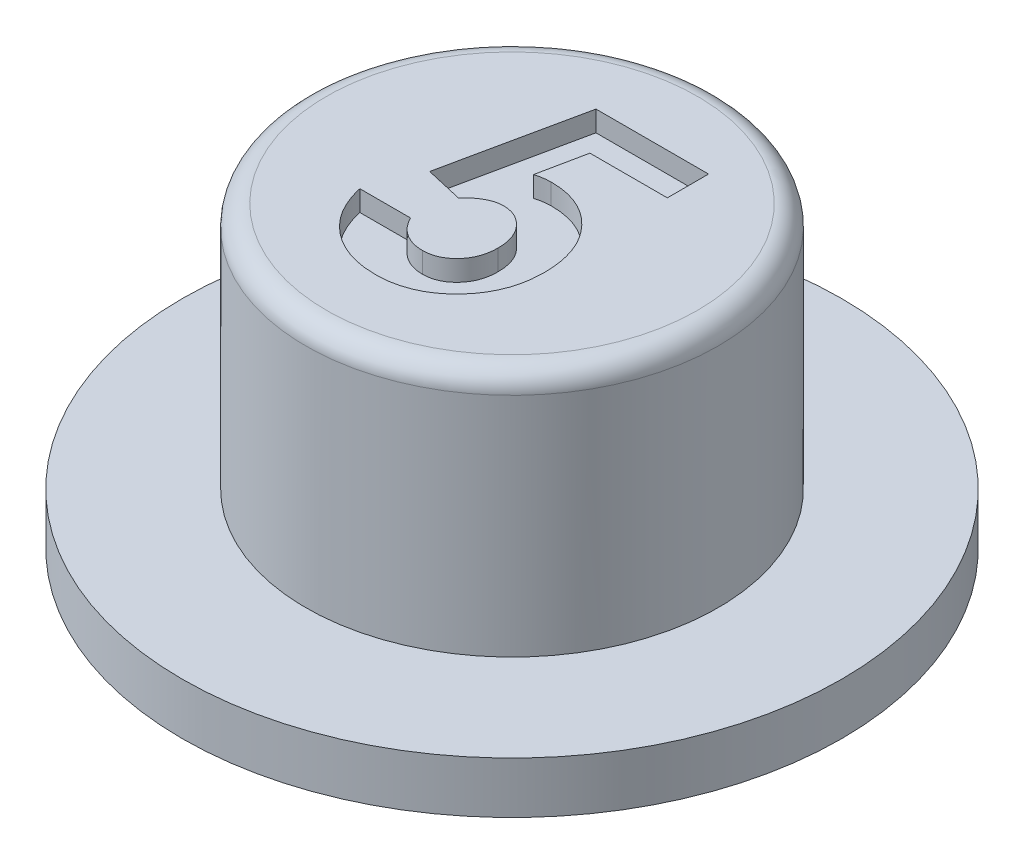
from build123d import *

# Parameters (mm, degrees)
SKETCH2_W          = 3.5
SKETCH2_H          = 2.5
CUT_EXTRUDE1_DEPTH = 3.5
FILLET1_R          = 0.5
CUT_EXTRUDE2_DEPTH = 0.5


with BuildPart() as part:
    # Sketch1 → Revolve1 (revolve)
    with BuildSketch(Plane.XY):
        Polygon((0, 7.25), (5, 7.25), (5, 1.25), (8, 1.25), (8, 0), (0, 0), align=None)
    revolve(axis=Axis((0, 7.25, 0), (0, -1, 0)))

    # Sketch2 → Cut-Extrude1 (cut)
    with BuildSketch(Plane.XZ):
        Rectangle(SKETCH2_W, SKETCH2_H)
    extrude(amount=-CUT_EXTRUDE1_DEPTH, mode=Mode.SUBTRACT)

    # Fillet1
    fillet1_edges = [part.edges().sort_by_distance(p)[0] for p in [
        (-5, 7.25, 0),
    ]]
    fillet(fillet1_edges, radius=FILLET1_R)

    # Sketch3 → Cut-Extrude2 (cut)
    with BuildSketch(Plane(origin=(0, 7.25, 0), x_dir=(1, 0, 0), z_dir=(0, 1, 0))):
        with BuildLine():
            Line((-0.962740385, 3), (1.769230769, 3))
            Line((1.769230769, 3), (1.769230769, 2))
            Line((1.769230769, 2), (-0.109375, 2))
            Line((-0.109375, 2), (-0.34375, 0.865384615))
            add(Edge.make_bspline(
                [(-0.34375, 0.865384615), (-0.311813051, 0.874279459), (-0.248826826, 0.891821918), (-0.153938001, 0.909414784), (-0.061977505, 0.920817921), (-0.001633589, 0.922338947), (0.027644231, 0.923076923)],
                knots=[0, 0, 0, 0, 1.05461699, 2.079921384, 3.068411212, 4, 4, 4, 4], degree=3))
            add(Edge.make_bspline(
                [(0.027644231, 0.923076923), (0.091443667, 0.921614996), (0.21720641, 0.918733216), (0.401181345, 0.89137572), (0.577348214, 0.848288493), (0.745167925, 0.786837219), (0.904476543, 0.706856797), (1.05546718, 0.610102908), (1.198325152, 0.496405615), (1.330512701, 0.365693734), (1.451972142, 0.22216913), (1.557574199, 0.066932084), (1.647764945, -0.097803875), (1.719499547, -0.273062741), (1.77611861, -0.457743771), (1.817032809, -0.651965315), (1.841227419, -0.855957554), (1.844489914, -0.995126873), (1.846153846, -1.066105769)],
                knots=[0, 0, 0, 0, 1.01440847, 1.999622559, 2.951875003, 3.895578053, 4.836219714, 5.782137149, 6.743708247, 7.735272588, 8.734977101, 9.730283169, 10.717124674, 11.717316708, 12.737475749, 13.78628267, 14.87096371, 16, 16, 16, 16], degree=3))
            add(Edge.make_bspline(
                [(1.846153846, -1.066105769), (1.844120495, -1.13789044), (1.840108097, -1.279542579), (1.813930883, -1.48782133), (1.767727629, -1.687305353), (1.704262837, -1.878528664), (1.620652036, -2.060085816), (1.520098604, -2.233857605), (1.400902455, -2.39855418), (1.264233311, -2.552487201), (1.115656024, -2.693184937), (0.957456286, -2.816957005), (0.790745498, -2.921110197), (0.615519637, -3.005283585), (0.43278403, -3.071880071), (0.242483215, -3.120359134), (0.043692354, -3.148159183), (-0.091260811, -3.151929666), (-0.159855769, -3.153846154)],
                knots=[0, 0, 0, 0, 1.06808661, 2.107647099, 3.116961351, 4.110378221, 5.100014249, 6.085620622, 7.093190682, 8.119403071, 9.144090782, 10.133780668, 11.103064255, 12.062861538, 13.020824475, 13.992378307, 14.979551724, 16, 16, 16, 16], degree=3))
            add(Edge.make_bspline(
                [(-0.159855769, -3.153846154), (-0.221198198, -3.152278347), (-0.342178305, -3.149186305), (-0.520376692, -3.130180984), (-0.692179725, -3.096579398), (-0.856675318, -3.047949202), (-1.01559424, -2.988096533), (-1.167099343, -2.913239459), (-1.312023174, -2.824803359), (-1.449954202, -2.724402196), (-1.578651246, -2.61130418), (-1.696112271, -2.487498915), (-1.8030484, -2.354546905), (-1.897171369, -2.210807929), (-1.97818613, -2.056494351), (-2.050031672, -1.893424792), (-2.108837968, -1.719896287), (-2.13868047, -1.599596687), (-2.153846154, -1.538461538)],
                knots=[0, 0, 0, 0, 1.054957082, 2.080596141, 3.077793124, 4.061112343, 5.027190972, 5.994718051, 6.962465889, 7.943658696, 8.924948258, 9.904494768, 10.875059, 11.855380583, 12.854004648, 13.869083016, 14.917087635, 16, 16, 16, 16], degree=3))
            Line((-2.153846154, -1.538461538), (-0.923076923, -1.538461538))
            add(Edge.make_bspline(
                [(-0.923076923, -1.538461538), (-0.900578432, -1.580825707), (-0.856855182, -1.663155633), (-0.773683893, -1.77246098), (-0.680578917, -1.865671884), (-0.578380109, -1.943699036), (-0.466425285, -2.002155651), (-0.349276393, -2.046486443), (-0.225461741, -2.072103566), (-0.141138496, -2.07530596), (-0.098557692, -2.076923077)],
                knots=[0, 0, 0, 0, 1.104910296, 2.147267069, 3.153527244, 4.136738762, 5.099945312, 6.05603338, 7.018353, 8, 8, 8, 8], degree=3))
            add(Edge.make_bspline(
                [(-0.098557692, -2.076923077), (-0.068879444, -2.075806444), (-0.010486989, -2.073609449), (0.075545059, -2.061986797), (0.157666428, -2.039973757), (0.236487672, -2.009490813), (0.312220524, -1.97147514), (0.383779327, -1.923482829), (0.452409076, -1.8682419), (0.517064948, -1.804852747), (0.575624531, -1.734188586), (0.626974881, -1.658255127), (0.672889174, -1.57873963), (0.706898594, -1.492492284), (0.734749432, -1.402088467), (0.755259916, -1.306846235), (0.767517243, -1.206654352), (0.768651944, -1.138256163), (0.769230769, -1.103365385)],
                knots=[0, 0, 0, 0, 0.978869489, 1.925942215, 2.855067702, 3.774946051, 4.70828698, 5.642468714, 6.60995405, 7.609372294, 8.622401667, 9.629904756, 10.629323, 11.642352373, 12.678539694, 13.745912462, 14.850161547, 16, 16, 16, 16], degree=3))
            add(Edge.make_bspline(
                [(0.769230769, -1.103365385), (0.768558976, -1.0692845), (0.767251313, -1.002945232), (0.75643407, -0.905535424), (0.737082229, -0.813111144), (0.710715181, -0.724964493), (0.67696221, -0.641630739), (0.635713824, -0.562613839), (0.586793806, -0.488313196), (0.529939513, -0.420241497), (0.46931068, -0.357804198), (0.404175831, -0.303197035), (0.335121798, -0.25787688), (0.264294348, -0.218311067), (0.188866306, -0.189515931), (0.110533744, -0.169685782), (0.02937904, -0.155135217), (-0.025974822, -0.154280318), (-0.054086538, -0.153846154)],
                knots=[0, 0, 0, 0, 1.166249705, 2.270133367, 3.348514167, 4.393962215, 5.415026464, 6.420877785, 7.440098956, 8.453121383, 9.451844239, 10.415694839, 11.355045125, 12.27538808, 13.187007209, 14.108269027, 15.039275622, 16, 16, 16, 16], degree=3))
            add(Edge.make_bspline(
                [(-0.054086538, -0.153846154), (-0.084622396, -0.15500482), (-0.145822806, -0.157327036), (-0.236751298, -0.176222283), (-0.326583444, -0.206801882), (-0.415818805, -0.248991285), (-0.503571565, -0.304203902), (-0.592157562, -0.368961971), (-0.678611632, -0.44797078), (-0.733581535, -0.506816721), (-0.762019231, -0.537259615)],
                knots=[0, 0, 0, 0, 0.88288272, 1.769486374, 2.674910571, 3.623812639, 4.617874466, 5.670434592, 6.794841017, 8, 8, 8, 8], degree=3))
            Line((-0.762019231, -0.537259615), (-1.668269231, -0.329326923))
            Line((-1.668269231, -0.329326923), (-0.962740385, 3))
        make_face()
    extrude(amount=-CUT_EXTRUDE2_DEPTH, mode=Mode.SUBTRACT)


solid = part.part
